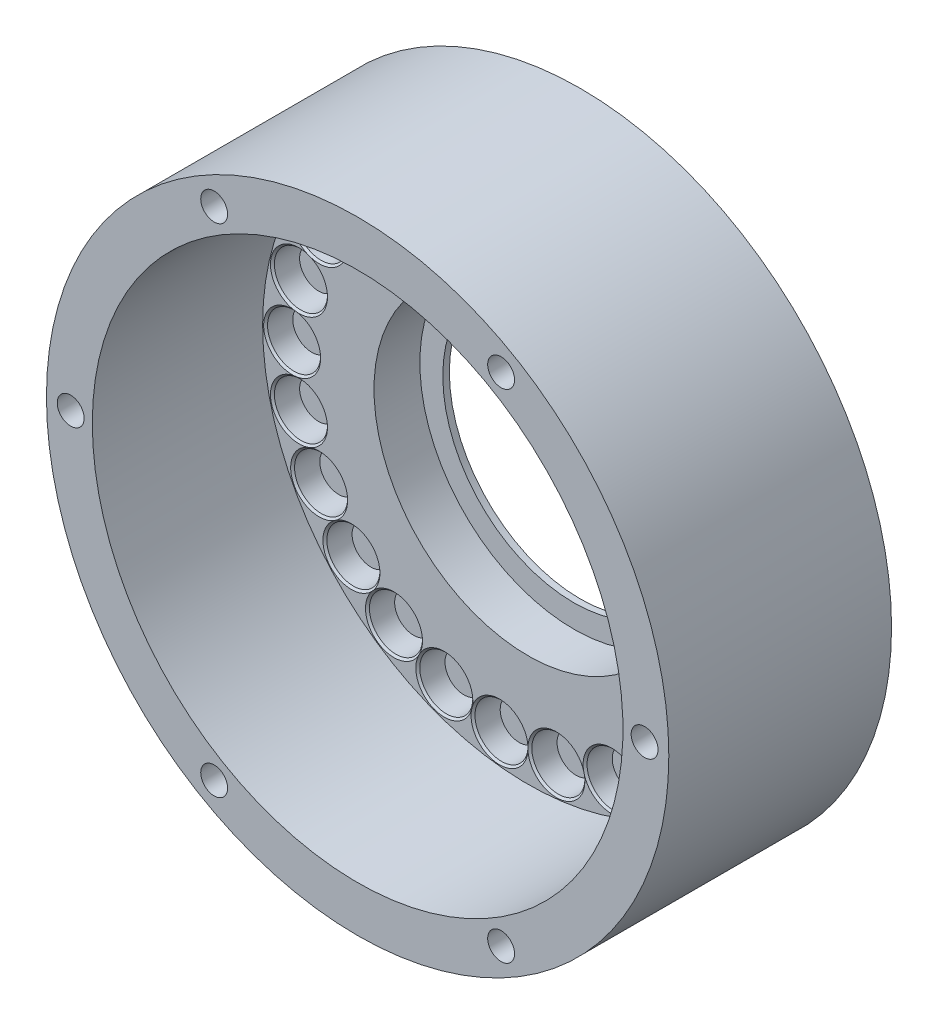
from build123d import *

# Parameters (mm, degrees)
SKETCH1_R           = 47.5
SKETCH1_R_2         = 4.05
BOSS_EXTRUDE1_DEPTH = 5
BOSS_EXTRUDE2_START = 3
SKETCH4_R           = 47.5
BOSS_EXTRUDE2_DEPTH = 3
SKETCH5_R           = 2.9
BOSS_EXTRUDE3_DEPTH = 2
SKETCH8_R           = 47.5
SKETCH8_R_2         = 40.5
BOSS_EXTRUDE5_DEPTH = 26
CUT_EXTRUDE1_REACH  = 77.289
SKETCH9_R           = 20
SKETCH10_R          = 23.5
CUT_EXTRUDE2_DEPTH  = 7
SKETCH11_R          = 2.05
CUT_EXTRUDE3_DEPTH  = 76.289441491
SKETCH12_R          = 2.6
CUT_EXTRUDE4_DEPTH  = 73.031243221
SKETCH13_R          = 2.6
CUT_EXTRUDE5_DEPTH  = 6
CHAMFER1_SIZE       = 0.3
SKETCH14_R          = 2.6
BOSS_EXTRUDE6_DEPTH = 2
CHAMFER2_SIZE       = 0.6


with BuildPart() as part:
    # Sketch1 → Boss-Extrude1 (new body)
    with BuildSketch(Plane.XY):
        Circle(SKETCH1_R)
        with Locations((36, 0)):
            Circle(SKETCH1_R_2, mode=Mode.SUBTRACT)
        with Locations((34.953905427, -8.615363914)):
            Circle(SKETCH1_R_2, mode=Mode.SUBTRACT)
        with Locations((31.876416924, -16.730034194)):
            Circle(SKETCH1_R_2, mode=Mode.SUBTRACT)
        with Locations((26.946386934, -23.872415697)):
            Circle(SKETCH1_R_2, mode=Mode.SUBTRACT)
        with Locations((20.450330882, -29.627419172)):
            Circle(SKETCH1_R_2, mode=Mode.SUBTRACT)
        with Locations((12.765775934, -33.660584737)):
            Circle(SKETCH1_R_2, mode=Mode.SUBTRACT)
        with Locations((4.339320489, -35.737519468)):
            Circle(SKETCH1_R_2, mode=Mode.SUBTRACT)
        with Locations((-4.339320489, -35.737519468)):
            Circle(SKETCH1_R_2, mode=Mode.SUBTRACT)
        with Locations((-12.765775934, -33.660584737)):
            Circle(SKETCH1_R_2, mode=Mode.SUBTRACT)
        with Locations((-20.450330882, -29.627419172)):
            Circle(SKETCH1_R_2, mode=Mode.SUBTRACT)
        with Locations((-26.946386934, -23.872415697)):
            Circle(SKETCH1_R_2, mode=Mode.SUBTRACT)
        with Locations((-31.876416924, -16.730034194)):
            Circle(SKETCH1_R_2, mode=Mode.SUBTRACT)
        with Locations((-34.953905427, -8.615363914)):
            Circle(SKETCH1_R_2, mode=Mode.SUBTRACT)
        with Locations((-36, 0)):
            Circle(SKETCH1_R_2, mode=Mode.SUBTRACT)
        with Locations((-34.953905427, 8.615363914)):
            Circle(SKETCH1_R_2, mode=Mode.SUBTRACT)
        with Locations((-31.876416924, 16.730034194)):
            Circle(SKETCH1_R_2, mode=Mode.SUBTRACT)
        with Locations((-26.946386934, 23.872415697)):
            Circle(SKETCH1_R_2, mode=Mode.SUBTRACT)
        with Locations((-20.450330882, 29.627419172)):
            Circle(SKETCH1_R_2, mode=Mode.SUBTRACT)
        with Locations((-12.765775934, 33.660584737)):
            Circle(SKETCH1_R_2, mode=Mode.SUBTRACT)
        with Locations((-4.339320489, 35.737519468)):
            Circle(SKETCH1_R_2, mode=Mode.SUBTRACT)
        with Locations((4.339320489, 35.737519468)):
            Circle(SKETCH1_R_2, mode=Mode.SUBTRACT)
        with Locations((12.765775934, 33.660584737)):
            Circle(SKETCH1_R_2, mode=Mode.SUBTRACT)
        with Locations((20.450330882, 29.627419172)):
            Circle(SKETCH1_R_2, mode=Mode.SUBTRACT)
        with Locations((26.946386934, 23.872415697)):
            Circle(SKETCH1_R_2, mode=Mode.SUBTRACT)
        with Locations((31.876416924, 16.730034194)):
            Circle(SKETCH1_R_2, mode=Mode.SUBTRACT)
        with Locations((34.953905427, 8.615363914)):
            Circle(SKETCH1_R_2, mode=Mode.SUBTRACT)
    extrude(amount=BOSS_EXTRUDE1_DEPTH)

    # Sketch4 → Boss-Extrude2 (add)
    with BuildSketch(Plane(origin=(0, 0, 0), x_dir=(-1, 0, 0), z_dir=(0, 0, -1)).offset(BOSS_EXTRUDE2_START)):
        Circle(SKETCH4_R)
    extrude(amount=-BOSS_EXTRUDE2_DEPTH)

    # Sketch5 → Boss-Extrude3 (add)
    with BuildSketch(Plane.XY):
        with Locations(Location((36, 0, 0), (0, 0, 180))):
            Circle(SKETCH5_R)
        with Locations(Location((34.953905427, -8.615363914, 0), (0, 0, 180))):
            Circle(SKETCH5_R)
        with Locations(Location((31.876416924, -16.730034194, 0), (0, 0, 180))):
            Circle(SKETCH5_R)
        with Locations(Location((26.946386934, -23.872415697, 0), (0, 0, 180))):
            Circle(SKETCH5_R)
        with Locations(Location((20.450330882, -29.627419172, 0), (0, 0, 180))):
            Circle(SKETCH5_R)
        with Locations(Location((12.765775934, -33.660584737, 0), (0, 0, 180))):
            Circle(SKETCH5_R)
        with Locations(Location((4.339320489, -35.737519468, 0), (0, 0, 180))):
            Circle(SKETCH5_R)
        with Locations(Location((-4.339320489, -35.737519468, 0), (0, 0, 180))):
            Circle(SKETCH5_R)
        with Locations(Location((-12.765775934, -33.660584737, 0), (0, 0, 180))):
            Circle(SKETCH5_R)
        with Locations(Location((-20.450330882, -29.627419172, 0), (0, 0, 180))):
            Circle(SKETCH5_R)
        with Locations(Location((-26.946386934, -23.872415697, 0), (0, 0, 180))):
            Circle(SKETCH5_R)
        with Locations(Location((-31.876416924, -16.730034194, 0), (0, 0, 180))):
            Circle(SKETCH5_R)
        with Locations(Location((-34.953905427, -8.615363914, 0), (0, 0, 180))):
            Circle(SKETCH5_R)
        with Locations(Location((-36, 0, 0), (0, 0, 180))):
            Circle(SKETCH5_R)
        with Locations(Location((-34.953905427, 8.615363914, 0), (0, 0, 180))):
            Circle(SKETCH5_R)
        with Locations(Location((-31.876416924, 16.730034194, 0), (0, 0, 180))):
            Circle(SKETCH5_R)
        with Locations(Location((-26.946386934, 23.872415697, 0), (0, 0, 180))):
            Circle(SKETCH5_R)
        with Locations(Location((-20.450330882, 29.627419172, 0), (0, 0, 180))):
            Circle(SKETCH5_R)
        with Locations(Location((-12.765775934, 33.660584737, 0), (0, 0, 180))):
            Circle(SKETCH5_R)
        with Locations(Location((-4.339320489, 35.737519468, 0), (0, 0, 180))):
            Circle(SKETCH5_R)
        with Locations(Location((4.339320489, 35.737519468, 0), (0, 0, 180))):
            Circle(SKETCH5_R)
        with Locations(Location((12.765775934, 33.660584737, 0), (0, 0, 180))):
            Circle(SKETCH5_R)
        with Locations(Location((20.450330882, 29.627419172, 0), (0, 0, 180))):
            Circle(SKETCH5_R)
        with Locations(Location((26.946386934, 23.872415697, 0), (0, 0, 180))):
            Circle(SKETCH5_R)
        with Locations(Location((31.876416924, 16.730034194, 0), (0, 0, 180))):
            Circle(SKETCH5_R)
        with Locations(Location((34.953905427, 8.615363914, 0), (0, 0, 180))):
            Circle(SKETCH5_R)
    extrude(amount=BOSS_EXTRUDE3_DEPTH)

    # Sketch8 → Boss-Extrude5 (add)
    with BuildSketch(Plane.XY.offset(5)):
        with Locations(Location((0, 0, 0), (0, 0, 180))):
            Circle(SKETCH8_R)
        with Locations(Location((0, 0, 0), (0, 0, 180))):
            Circle(SKETCH8_R_2, mode=Mode.SUBTRACT)
    extrude(amount=BOSS_EXTRUDE5_DEPTH)

    # Sketch9 → Cut-Extrude1 (cut, up to next)
    with BuildSketch(Plane(origin=(0, 0, -3), x_dir=(-1, 0, 0), z_dir=(0, 0, -1)), mode=Mode.PRIVATE) as cut_extrude1_sk1:
        Circle(SKETCH9_R)
    cut_extrude1_tool1 = extrude(cut_extrude1_sk1.sketch, amount=-CUT_EXTRUDE1_REACH, mode=Mode.PRIVATE) & part.part
    add(cut_extrude1_tool1.solids().sort_by_distance((0, 0, -3))[0], mode=Mode.SUBTRACT)

    # Sketch10 → Cut-Extrude2 (cut)
    with BuildSketch(Plane.XY.offset(5)):
        Circle(SKETCH10_R)
    extrude(amount=-CUT_EXTRUDE2_DEPTH, mode=Mode.SUBTRACT)

    # Sketch11 → Cut-Extrude3 (cut, through all)
    with BuildSketch(Plane(origin=(0, 0, -3), x_dir=(-1, 0, 0), z_dir=(0, 0, -1))):
        with Locations((43.8, 0)):
            Circle(SKETCH11_R)
        with Locations((21.9, -37.931912686)):
            Circle(SKETCH11_R)
        with Locations((-21.9, -37.931912686)):
            Circle(SKETCH11_R)
        with Locations((-43.8, 0)):
            Circle(SKETCH11_R)
        with Locations((-21.9, 37.931912686)):
            Circle(SKETCH11_R)
        with Locations((21.9, 37.931912686)):
            Circle(SKETCH11_R)
    extrude(amount=-CUT_EXTRUDE3_DEPTH, mode=Mode.SUBTRACT)

    # Sketch12 → Cut-Extrude4 (cut, through all)
    with BuildSketch(Plane.XY.offset(5)):
        with Locations((8.80698434, 27.105110714)):
            Circle(SKETCH12_R)
        with Locations(Location((-8.80698434, 27.105110714, 0), (0, 0, 180))):
            Circle(SKETCH12_R)
        with Locations((-8.80698434, -27.105110714)):
            Circle(SKETCH12_R)
        with Locations(Location((8.80698434, -27.105110714, 0), (0, 0, 180))):
            Circle(SKETCH12_R)
    extrude(amount=-CUT_EXTRUDE4_DEPTH, mode=Mode.SUBTRACT)

    # Sketch13 → Cut-Extrude5 (cut)
    with BuildSketch(Plane(origin=(0, 0, -3), x_dir=(-1, 0, 0), z_dir=(0, 0, -1))):
        with Locations((-21.9, 37.931912686)):
            Circle(SKETCH13_R)
        with Locations((21.9, 37.931912686)):
            Circle(SKETCH13_R)
        with Locations((43.8, 0)):
            Circle(SKETCH13_R)
        with Locations((21.9, -37.931912686)):
            Circle(SKETCH13_R)
        with Locations((-21.9, -37.931912686)):
            Circle(SKETCH13_R)
        with Locations((-43.8, 0)):
            Circle(SKETCH13_R)
    extrude(amount=-CUT_EXTRUDE5_DEPTH, mode=Mode.SUBTRACT)

    # Chamfer1
    # the kernel refuses this chamfer: 0.3 mm, written as the material it takes off along each edge
    with BuildSketch(Plane(origin=(34.953905427, 8.615363914, 5), x_dir=(1, 0, 0), z_dir=(0, -1, 0))) as chamfer1_piece_1:
        Polygon((4.05 + CHAMFER1_SIZE, 0), (4.05, -CHAMFER1_SIZE), (4.05, 0), align=None)
    revolve(axis=Axis((34.953905427, 8.615363914, 5), (0, 0, 1)), mode=Mode.SUBTRACT)
    with BuildSketch(Plane(origin=(31.876416924, -16.730034194, 5), x_dir=(1, 0, 0), z_dir=(0, -1, 0))) as chamfer1_piece_2:
        Polygon((4.05 + CHAMFER1_SIZE, 0), (4.05, -CHAMFER1_SIZE), (4.05, 0), align=None)
    revolve(axis=Axis((31.876416924, -16.730034194, 5), (0, 0, 1)), mode=Mode.SUBTRACT)
    with BuildSketch(Plane(origin=(26.946386934, -23.872415697, 5), x_dir=(1, 0, 0), z_dir=(0, -1, 0))) as chamfer1_piece_3:
        Polygon((4.05 + CHAMFER1_SIZE, 0), (4.05, -CHAMFER1_SIZE), (4.05, 0), align=None)
    revolve(axis=Axis((26.946386934, -23.872415697, 5), (0, 0, 1)), mode=Mode.SUBTRACT)
    with BuildSketch(Plane(origin=(20.450330882, -29.627419172, 5), x_dir=(1, 0, 0), z_dir=(0, -1, 0))) as chamfer1_piece_4:
        Polygon((4.05 + CHAMFER1_SIZE, 0), (4.05, -CHAMFER1_SIZE), (4.05, 0), align=None)
    revolve(axis=Axis((20.450330882, -29.627419172, 5), (0, 0, 1)), mode=Mode.SUBTRACT)
    with BuildSketch(Plane(origin=(12.765775934, -33.660584737, 5), x_dir=(1, 0, 0), z_dir=(0, -1, 0))) as chamfer1_piece_5:
        Polygon((4.05 + CHAMFER1_SIZE, 0), (4.05, -CHAMFER1_SIZE), (4.05, 0), align=None)
    revolve(axis=Axis((12.765775934, -33.660584737, 5), (0, 0, 1)), mode=Mode.SUBTRACT)
    with BuildSketch(Plane(origin=(4.339320489, -35.737519468, 5), x_dir=(1, 0, 0), z_dir=(0, -1, 0))) as chamfer1_piece_6:
        Polygon((4.05 + CHAMFER1_SIZE, 0), (4.05, -CHAMFER1_SIZE), (4.05, 0), align=None)
    revolve(axis=Axis((4.339320489, -35.737519468, 5), (0, 0, 1)), mode=Mode.SUBTRACT)
    with BuildSketch(Plane(origin=(-4.339320489, -35.737519468, 5), x_dir=(1, 0, 0), z_dir=(0, -1, 0))) as chamfer1_piece_7:
        Polygon((4.05 + CHAMFER1_SIZE, 0), (4.05, -CHAMFER1_SIZE), (4.05, 0), align=None)
    revolve(axis=Axis((-4.339320489, -35.737519468, 5), (0, 0, 1)), mode=Mode.SUBTRACT)
    with BuildSketch(Plane(origin=(-12.765775934, -33.660584737, 5), x_dir=(1, 0, 0), z_dir=(0, -1, 0))) as chamfer1_piece_8:
        Polygon((4.05 + CHAMFER1_SIZE, 0), (4.05, -CHAMFER1_SIZE), (4.05, 0), align=None)
    revolve(axis=Axis((-12.765775934, -33.660584737, 5), (0, 0, 1)), mode=Mode.SUBTRACT)
    with BuildSketch(Plane(origin=(-20.450330882, -29.627419172, 5), x_dir=(1, 0, 0), z_dir=(0, -1, 0))) as chamfer1_piece_9:
        Polygon((4.05 + CHAMFER1_SIZE, 0), (4.05, -CHAMFER1_SIZE), (4.05, 0), align=None)
    revolve(axis=Axis((-20.450330882, -29.627419172, 5), (0, 0, 1)), mode=Mode.SUBTRACT)
    with BuildSketch(Plane(origin=(-26.946386934, -23.872415697, 5), x_dir=(1, 0, 0), z_dir=(0, -1, 0))) as chamfer1_piece_10:
        Polygon((4.05 + CHAMFER1_SIZE, 0), (4.05, -CHAMFER1_SIZE), (4.05, 0), align=None)
    revolve(axis=Axis((-26.946386934, -23.872415697, 5), (0, 0, 1)), mode=Mode.SUBTRACT)
    with BuildSketch(Plane(origin=(-31.876416924, -16.730034194, 5), x_dir=(1, 0, 0), z_dir=(0, -1, 0))) as chamfer1_piece_11:
        Polygon((4.05 + CHAMFER1_SIZE, 0), (4.05, -CHAMFER1_SIZE), (4.05, 0), align=None)
    revolve(axis=Axis((-31.876416924, -16.730034194, 5), (0, 0, 1)), mode=Mode.SUBTRACT)
    with BuildSketch(Plane(origin=(-34.953905427, -8.615363914, 5), x_dir=(1, 0, 0), z_dir=(0, -1, 0))) as chamfer1_piece_12:
        Polygon((4.05 + CHAMFER1_SIZE, 0), (4.05, -CHAMFER1_SIZE), (4.05, 0), align=None)
    revolve(axis=Axis((-34.953905427, -8.615363914, 5), (0, 0, 1)), mode=Mode.SUBTRACT)
    with BuildSketch(Plane(origin=(36, 0, 5), x_dir=(1, 0, 0), z_dir=(0, -1, 0))) as chamfer1_piece_13:
        Polygon((4.05 + CHAMFER1_SIZE, 0), (4.05, -CHAMFER1_SIZE), (4.05, 0), align=None)
    revolve(axis=Axis((36, 0, 5), (0, 0, 1)), mode=Mode.SUBTRACT)
    with BuildSketch(Plane(origin=(-36, 0, 5), x_dir=(1, 0, 0), z_dir=(0, -1, 0))) as chamfer1_piece_14:
        Polygon((4.05 + CHAMFER1_SIZE, 0), (4.05, -CHAMFER1_SIZE), (4.05, 0), align=None)
    revolve(axis=Axis((-36, 0, 5), (0, 0, 1)), mode=Mode.SUBTRACT)
    with BuildSketch(Plane(origin=(-34.953905427, 8.615363914, 5), x_dir=(1, 0, 0), z_dir=(0, -1, 0))) as chamfer1_piece_15:
        Polygon((4.05 + CHAMFER1_SIZE, 0), (4.05, -CHAMFER1_SIZE), (4.05, 0), align=None)
    revolve(axis=Axis((-34.953905427, 8.615363914, 5), (0, 0, 1)), mode=Mode.SUBTRACT)
    with BuildSketch(Plane(origin=(-31.876416924, 16.730034194, 5), x_dir=(1, 0, 0), z_dir=(0, -1, 0))) as chamfer1_piece_16:
        Polygon((4.05 + CHAMFER1_SIZE, 0), (4.05, -CHAMFER1_SIZE), (4.05, 0), align=None)
    revolve(axis=Axis((-31.876416924, 16.730034194, 5), (0, 0, 1)), mode=Mode.SUBTRACT)
    with BuildSketch(Plane(origin=(-26.946386934, 23.872415697, 5), x_dir=(1, 0, 0), z_dir=(0, -1, 0))) as chamfer1_piece_17:
        Polygon((4.05 + CHAMFER1_SIZE, 0), (4.05, -CHAMFER1_SIZE), (4.05, 0), align=None)
    revolve(axis=Axis((-26.946386934, 23.872415697, 5), (0, 0, 1)), mode=Mode.SUBTRACT)
    with BuildSketch(Plane(origin=(-20.450330882, 29.627419172, 5), x_dir=(1, 0, 0), z_dir=(0, -1, 0))) as chamfer1_piece_18:
        Polygon((4.05 + CHAMFER1_SIZE, 0), (4.05, -CHAMFER1_SIZE), (4.05, 0), align=None)
    revolve(axis=Axis((-20.450330882, 29.627419172, 5), (0, 0, 1)), mode=Mode.SUBTRACT)
    with BuildSketch(Plane(origin=(-12.765775934, 33.660584737, 5), x_dir=(1, 0, 0), z_dir=(0, -1, 0))) as chamfer1_piece_19:
        Polygon((4.05 + CHAMFER1_SIZE, 0), (4.05, -CHAMFER1_SIZE), (4.05, 0), align=None)
    revolve(axis=Axis((-12.765775934, 33.660584737, 5), (0, 0, 1)), mode=Mode.SUBTRACT)
    with BuildSketch(Plane(origin=(-4.339320489, 35.737519468, 5), x_dir=(1, 0, 0), z_dir=(0, -1, 0))) as chamfer1_piece_20:
        Polygon((4.05 + CHAMFER1_SIZE, 0), (4.05, -CHAMFER1_SIZE), (4.05, 0), align=None)
    revolve(axis=Axis((-4.339320489, 35.737519468, 5), (0, 0, 1)), mode=Mode.SUBTRACT)
    with BuildSketch(Plane(origin=(4.339320489, 35.737519468, 5), x_dir=(1, 0, 0), z_dir=(0, -1, 0))) as chamfer1_piece_21:
        Polygon((4.05 + CHAMFER1_SIZE, 0), (4.05, -CHAMFER1_SIZE), (4.05, 0), align=None)
    revolve(axis=Axis((4.339320489, 35.737519468, 5), (0, 0, 1)), mode=Mode.SUBTRACT)
    with BuildSketch(Plane(origin=(12.765775934, 33.660584737, 5), x_dir=(1, 0, 0), z_dir=(0, -1, 0))) as chamfer1_piece_22:
        Polygon((4.05 + CHAMFER1_SIZE, 0), (4.05, -CHAMFER1_SIZE), (4.05, 0), align=None)
    revolve(axis=Axis((12.765775934, 33.660584737, 5), (0, 0, 1)), mode=Mode.SUBTRACT)
    with BuildSketch(Plane(origin=(20.450330882, 29.627419172, 5), x_dir=(1, 0, 0), z_dir=(0, -1, 0))) as chamfer1_piece_23:
        Polygon((4.05 + CHAMFER1_SIZE, 0), (4.05, -CHAMFER1_SIZE), (4.05, 0), align=None)
    revolve(axis=Axis((20.450330882, 29.627419172, 5), (0, 0, 1)), mode=Mode.SUBTRACT)
    with BuildSketch(Plane(origin=(34.953905427, -8.615363914, 5), x_dir=(1, 0, 0), z_dir=(0, -1, 0))) as chamfer1_piece_24:
        Polygon((4.05 + CHAMFER1_SIZE, 0), (4.05, -CHAMFER1_SIZE), (4.05, 0), align=None)
    revolve(axis=Axis((34.953905427, -8.615363914, 5), (0, 0, 1)), mode=Mode.SUBTRACT)
    with BuildSketch(Plane(origin=(26.946386934, 23.872415697, 5), x_dir=(1, 0, 0), z_dir=(0, -1, 0))) as chamfer1_piece_25:
        Polygon((4.05 + CHAMFER1_SIZE, 0), (4.05, -CHAMFER1_SIZE), (4.05, 0), align=None)
    revolve(axis=Axis((26.946386934, 23.872415697, 5), (0, 0, 1)), mode=Mode.SUBTRACT)
    with BuildSketch(Plane(origin=(31.876416924, 16.730034194, 5), x_dir=(1, 0, 0), z_dir=(0, -1, 0))) as chamfer1_piece_26:
        Polygon((4.05 + CHAMFER1_SIZE, 0), (4.05, -CHAMFER1_SIZE), (4.05, 0), align=None)
    revolve(axis=Axis((31.876416924, 16.730034194, 5), (0, 0, 1)), mode=Mode.SUBTRACT)

    # Sketch14 → Boss-Extrude6 (add)
    with BuildSketch(Plane.XY.offset(5)):
        with Locations((-8.80698434, -27.105110714)):
            Circle(SKETCH14_R)
        with Locations((8.80698434, -27.105110714)):
            Circle(SKETCH14_R)
        with Locations((8.80698434, 27.105110714)):
            Circle(SKETCH14_R)
        with Locations((-8.80698434, 27.105110714)):
            Circle(SKETCH14_R)
    extrude(amount=-BOSS_EXTRUDE6_DEPTH)

    # Chamfer2
    # the kernel refuses this chamfer: 0.6 mm, written as the material it takes off along each edge
    with BuildSketch(Plane(origin=(21.9, 37.931912686, 3), x_dir=(-1, 0, 0), z_dir=(0, -1, 0))) as chamfer2_piece_1_section:
        Polygon((2.05, -CHAMFER2_SIZE), (2.05 + CHAMFER2_SIZE, 0), (2.05, 0), align=None)
    chamfer2_piece_1 = revolve(axis=Axis((21.9, 37.931912686, 3), (0, 0, -1)), mode=Mode.PRIVATE)
    chamfer2_piece_1 = chamfer2_piece_1 & Plane(origin=(21.9, 37.931912686, 3.323578203), x_dir=(-1, 0, 0), z_dir=(0, 0, -1)) * Cylinder(2.6, 11, mode=Mode.PRIVATE)
    add(chamfer2_piece_1, mode=Mode.SUBTRACT)
    with BuildSketch(Plane(origin=(43.8, 0, 3), x_dir=(-1, 0, 0), z_dir=(0, -1, 0))) as chamfer2_piece_2_section:
        Polygon((2.05, -CHAMFER2_SIZE), (2.05 + CHAMFER2_SIZE, 0), (2.05, 0), align=None)
    chamfer2_piece_2 = revolve(axis=Axis((43.8, 0, 3), (0, 0, -1)), mode=Mode.PRIVATE)
    chamfer2_piece_2 = chamfer2_piece_2 & Plane(origin=(43.8, 0, 3.323578203), x_dir=(-1, 0, 0), z_dir=(0, 0, -1)) * Cylinder(2.6, 11, mode=Mode.PRIVATE)
    add(chamfer2_piece_2, mode=Mode.SUBTRACT)
    with BuildSketch(Plane(origin=(21.9, -37.931912686, 3), x_dir=(-1, 0, 0), z_dir=(0, -1, 0))) as chamfer2_piece_3_section:
        Polygon((2.05, -CHAMFER2_SIZE), (2.05 + CHAMFER2_SIZE, 0), (2.05, 0), align=None)
    chamfer2_piece_3 = revolve(axis=Axis((21.9, -37.931912686, 3), (0, 0, -1)), mode=Mode.PRIVATE)
    chamfer2_piece_3 = chamfer2_piece_3 & Plane(origin=(21.9, -37.931912686, 3.323578203), x_dir=(-1, 0, 0), z_dir=(0, 0, -1)) * Cylinder(2.6, 11, mode=Mode.PRIVATE)
    add(chamfer2_piece_3, mode=Mode.SUBTRACT)
    with BuildSketch(Plane(origin=(-21.9, -37.931912686, 3), x_dir=(-1, 0, 0), z_dir=(0, -1, 0))) as chamfer2_piece_4_section:
        Polygon((2.05, -CHAMFER2_SIZE), (2.05 + CHAMFER2_SIZE, 0), (2.05, 0), align=None)
    chamfer2_piece_4 = revolve(axis=Axis((-21.9, -37.931912686, 3), (0, 0, -1)), mode=Mode.PRIVATE)
    chamfer2_piece_4 = chamfer2_piece_4 & Plane(origin=(-21.9, -37.931912686, 3.323578203), x_dir=(-1, 0, 0), z_dir=(0, 0, -1)) * Cylinder(2.6, 11, mode=Mode.PRIVATE)
    add(chamfer2_piece_4, mode=Mode.SUBTRACT)
    with BuildSketch(Plane(origin=(-43.8, 0, 3), x_dir=(-1, 0, 0), z_dir=(0, -1, 0))) as chamfer2_piece_5_section:
        Polygon((2.05, -CHAMFER2_SIZE), (2.05 + CHAMFER2_SIZE, 0), (2.05, 0), align=None)
    chamfer2_piece_5 = revolve(axis=Axis((-43.8, 0, 3), (0, 0, -1)), mode=Mode.PRIVATE)
    chamfer2_piece_5 = chamfer2_piece_5 & Plane(origin=(-43.8, 0, 3.323578203), x_dir=(-1, 0, 0), z_dir=(0, 0, -1)) * Cylinder(2.6, 11, mode=Mode.PRIVATE)
    add(chamfer2_piece_5, mode=Mode.SUBTRACT)
    with BuildSketch(Plane(origin=(-21.9, 37.931912686, 3), x_dir=(-1, 0, 0), z_dir=(0, -1, 0))) as chamfer2_piece_6_section:
        Polygon((2.05 + CHAMFER2_SIZE, 0), (2.05, -CHAMFER2_SIZE), (2.05, 0), align=None)
    chamfer2_piece_6 = revolve(axis=Axis((-21.9, 37.931912686, 3), (0, 0, -1)), mode=Mode.PRIVATE)
    chamfer2_piece_6 = chamfer2_piece_6 & Plane(origin=(-21.9, 37.931912686, 3.323578203), x_dir=(-1, 0, 0), z_dir=(0, 0, -1)) * Cylinder(2.6, 11, mode=Mode.PRIVATE)
    add(chamfer2_piece_6, mode=Mode.SUBTRACT)


solid = part.part
